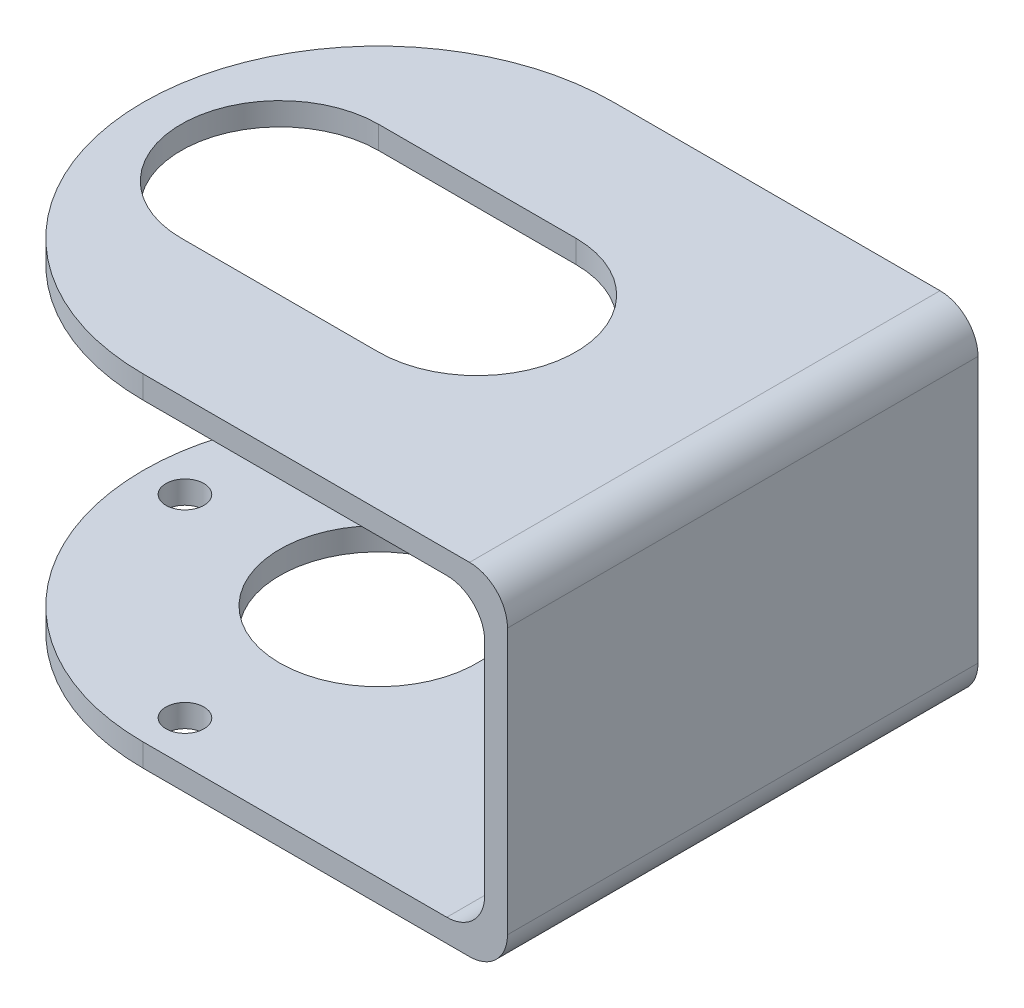
from build123d import *

# Parameters (mm, degrees)
SKETCH1_R           = 13
SKETCH1_R_2         = 2.5
BOSS_EXTRUDE1_DEPTH = 3
SKETCH2_W           = 62
SKETCH2_H           = 45
BOSS_EXTRUDE2_DEPTH = 3
BOSS_EXTRUDE3_START = 42
BOSS_EXTRUDE3_DEPTH = 3
CUT_EXTRUDE1_REACH  = 74.732
FILLET1_R           = 5


# Read off the part's stored shape, not the designer's step: Boss-Extrude3
with BuildPart() as part:
    # Sketch1 → Boss-Extrude1 (new body)
    with BuildSketch(Plane(origin=(0, 0, 0), x_dir=(1, 0, 0), z_dir=(0, 1, 0))):
        with BuildLine():
            Line((0, 31), (45, 31))
            Line((45, 31), (45, -31))
            Line((45, -31), (0, -31))
            ThreePointArc((0, -31), (-31, 0), (0, 31))
        make_face()
        with Locations(Location((0, 0, 0), (0, 0, 270))):
            Circle(SKETCH1_R, mode=Mode.SUBTRACT)
        with Locations(Location((0, 25.5, 0), (0, 0, 270))):
            Circle(SKETCH1_R_2, mode=Mode.SUBTRACT)
        with Locations(Location((-25.5, 0, 0), (0, 0, 270))):
            Circle(SKETCH1_R_2, mode=Mode.SUBTRACT)
        with Locations(Location((0, -25.5, 0), (0, 0, 270))):
            Circle(SKETCH1_R_2, mode=Mode.SUBTRACT)
        with Locations(Location((25.5, 0, 0), (0, 0, 270))):
            Circle(SKETCH1_R_2, mode=Mode.SUBTRACT)
    extrude(amount=BOSS_EXTRUDE1_DEPTH)

    # Sketch2 → Boss-Extrude2 (add)
    with BuildSketch(Plane(origin=(45, 0, 0), x_dir=(0, 0, -1), z_dir=(1, 0, 0))):
        with Locations((0, 22.5)):
            Rectangle(SKETCH2_W, SKETCH2_H)
    extrude(amount=BOSS_EXTRUDE2_DEPTH)

    # Boss-Extrude3 outline → Boss-Extrude3 (add)
    with BuildSketch(Plane(origin=(0, 0, 0), x_dir=(1, 0, 0), z_dir=(0, 1, 0)).offset(BOSS_EXTRUDE3_START)):
        with BuildLine():
            ThreePointArc((0, 31), (-31, 0), (0, -31))
            Line((0, -31), (45, -31))
            Line((45, -31), (45, 31))
            Line((45, 31), (0, 31))
        make_face()
    extrude(amount=BOSS_EXTRUDE3_DEPTH)

    # Sketch4 → Cut-Extrude1 (cut, up to next)
    with BuildSketch(Plane(origin=(0, 45, 0), x_dir=(1, 0, 0), z_dir=(0, 1, 0)), mode=Mode.PRIVATE) as cut_extrude1_sk1:
        with BuildLine():
            Line((13, -13), (-13, -13))
            ThreePointArc((-13, -13), (-26, 0), (-13, 13))
            Line((-13, 13), (13, 13))
            ThreePointArc((13, 13), (26, 0), (13, -13))
        make_face()
    cut_extrude1_tool1 = extrude(cut_extrude1_sk1.sketch, amount=-CUT_EXTRUDE1_REACH, mode=Mode.PRIVATE) & part.part
    add(cut_extrude1_tool1.solids().sort_by_distance((0, 45, 0))[0], mode=Mode.SUBTRACT)

    # Fillet1
    fillet1_edges = [part.edges().sort_by_distance(p)[0] for p in [
        (45, 3, 0),
        (48, 0, 0),
        (48, 45, 0),
        (45, 42, 0),
    ]]
    fillet(fillet1_edges, radius=FILLET1_R)


solid = part.part
